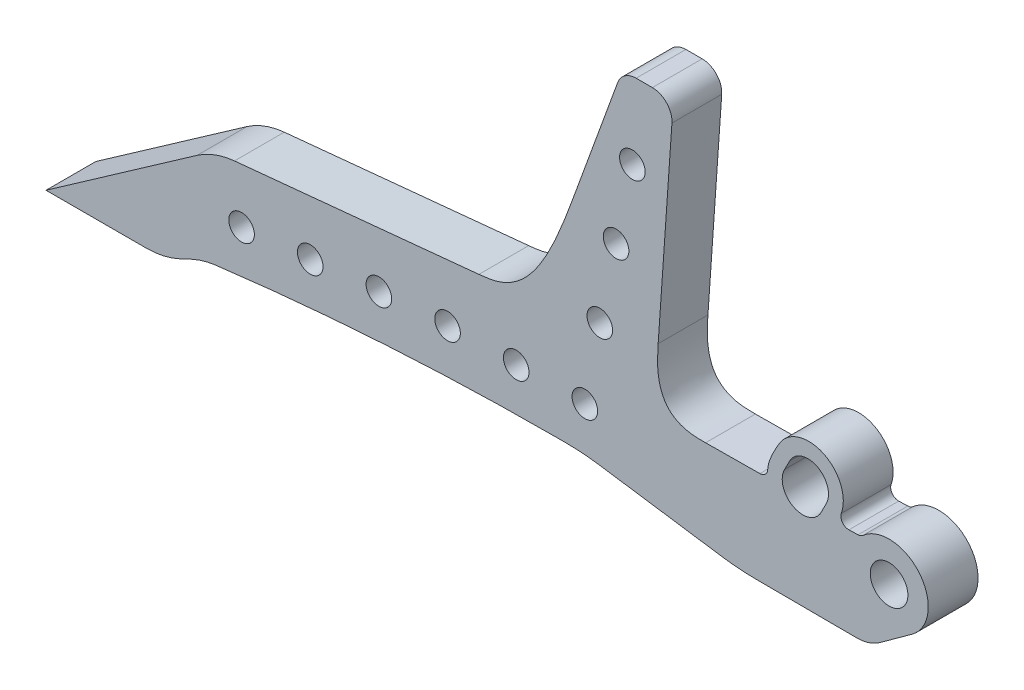
from build123d import *

# Parameters (mm, degrees)
SKETCH1_R               = 3.2639000000591807
SKETCH1_R_2             = 3.26389999999995
SKETCH1_R_3             = 3.263899999999988
SKETCH1_R_4             = 3.2638999999999796
SKETCH1_R_5             = 4.802500000000001
BOSS_EXTRUDE1_DEPTH     = 12.7
EXTRUDE_THIN1_DEPTH     = 12.7
FILLET6_R               = 2
FILLET3_R               = 1
FILLET4_R               = 2
BOSS_EXTRUDE5_DEPTH     = 12.7
CUT_EXTRUDE8_DEPTH      = 12.7
FILLET13_R              = 100
FILLET14_R              = 2
CUT_EXTRUDE9_DEPTH      = 12.7
FILLET16_R              = 2
BOSS_EXTRUDE6_DEPTH     = 12.7
SKETCH18_R              = 3.2638999999999863
CUT_EXTRUDE10_DEPTH     = 12.7
FILLET17_R              = 2
CUT_EXTRUDE11_DEPTH     = 12.7
BOSS_EXTRUDE7_START     = -12.7
BOSS_EXTRUDE7_DEPTH     = 12.7
DELETEFACE1_DEPTH       = 12.7
MOVE_FACE1_DEPTH        = 12.7
MOVE_FACE1_2_DEPTH      = 12.7
MOVE_FACE2_DEPTH        = 12.7
MOVE_FACE2_2_DEPTH      = 12.7
SKETCH27_R              = 3.2639000000000102
CUT_EXTRUDE12_DEPTH     = 12.7
FILLET18_R              = 15
FILLET19_R              = 1
FILLET20_R              = 2
MOVE_START              = -1
MOVE_FACE3_DEPTH        = 15
MOVE_FACE3_2_DEPTH      = 12.7
FILLET21_R              = 2
SKETCH30_R              = 3.2638999999999223
BOSS_EXTRUDE8_DEPTH     = 12.7
FILLET22_DEPTH          = 12.7
FILLET23_OUTLINE_R      = 3.2639
FILLET23_OUTLINE_R_2    = 4.8025
FILLET23_DEPTH          = 12.7
DELETEFACE2_DEPTH       = 12.7
FILLET24_R              = 5
FILLET25_R              = 20
F_1_4_CLEARANCE_HOLE1_D = 6.5278
FILLET26_R              = 10
MOVE_FACE4_DEPTH        = 15
MOVE_FACE4_2_DEPTH      = 12.7
DELETEFACE3_OUTLINE_R   = 3.2639
DELETEFACE3_DEPTH       = 12.7
CUT_EXTRUDE13_DEPTH     = 255.47732308394177
FILLET27_R              = 60
MOVE_FACE5_DEPTH        = 15
MOVE_FACE5_2_DEPTH      = 12.7
MOVE_FACE6_DEPTH        = 15
MOVE_FACE6_2_DEPTH      = 12.7
MOVE_FACE7_DEPTH        = 15
MOVE_FACE7_2_DEPTH      = 12.7


with BuildPart() as part:
    # Sketch1 → Boss-Extrude1 (new body)
    with BuildSketch(Plane.XY):
        with BuildLine():
            Line((-266.80143657759584, 66.76218641072877), (-251.10143657759588, 66.76218641072877))
            Line((-251.10143657759588, 66.76218641072877), (-241.10143657759585, 68.76218641072877))
            Line((-241.10143657759585, 68.76218641072877), (18.198563422404163, 71.2621864107288))
            Line((18.198563422404145, 71.2621864107288), (29.067448443455156, 79.14050878285678))
            ThreePointArc((29.06744844345514, 79.1405087828568), (30.77367137747385, 93.76541277544987), (16.057134993861304, 94.23718641072878))
            Line((16.05713499386129, 94.2371864107288), (-218.52884836858982, 87.76218641072877))
            Line((-218.52884836858982, 87.76218641072877), (-214.52884836858982, 97.76218641072876))
            Line((-214.52884836858982, 97.76218641072876), (-222.52884836858982, 97.76218641072877))
            Line((-222.52884836858982, 97.76218641072877), (-266.80143657759584, 66.76218641072877))
        make_face()
        with Locations((-211.80143657765504, 78.4962764755336)):
            Circle(SKETCH1_R, mode=Mode.SUBTRACT)
        with BuildLine():
            ThreePointArc((-197.55477153455325, 78.76140530191546), (-194.35216687234313, 82.08547055362008), (-191.0281016206385, 78.88286589140998))
            ThreePointArc((-191.0281016206385, 78.88286589140998), (-194.23070628284862, 75.55880063970532), (-197.55477153455325, 78.76140530191546))
        make_face(mode=Mode.SUBTRACT)
        with BuildLine():
            ThreePointArc((-180.04477153455318, 79.08726442304459), (-176.84216687234314, 82.41132967474914), (-173.5181016206386, 79.2087250125391))
            ThreePointArc((-173.5181016206386, 79.2087250125391), (-176.72070628284862, 75.88465976083455), (-180.04477153455318, 79.08726442304459))
        make_face(mode=Mode.SUBTRACT)
        with BuildLine():
            ThreePointArc((-162.53477153455316, 79.41312354417374), (-159.33216687234312, 82.73718879587831), (-156.00810162063857, 79.53458413366826))
            ThreePointArc((-156.00810162063857, 79.53458413366826), (-159.2107062828486, 76.2105188819637), (-162.53477153455316, 79.41312354417374))
        make_face(mode=Mode.SUBTRACT)
        with BuildLine():
            ThreePointArc((-145.02477153455317, 79.73898266530287), (-141.82216687234313, 83.06304791700741), (-138.49810162063858, 79.86044325479739))
            ThreePointArc((-138.49810162063858, 79.86044325479739), (-141.7007062828486, 76.53637800309285), (-145.02477153455317, 79.73898266530287))
        make_face(mode=Mode.SUBTRACT)
        with Locations((-124.25143657759587, 80.12557208117926)):
            Circle(SKETCH1_R_2, mode=Mode.SUBTRACT)
        with Locations((-106.74446789095614, 80.45137478990934)):
            Circle(SKETCH1_R_3, mode=Mode.SUBTRACT)
        with Locations((-89.23749920431642, 80.77717749863945)):
            Circle(SKETCH1_R_4, mode=Mode.SUBTRACT)
        with Locations((-71.72749920431643, 81.10303661976857)):
            Circle(SKETCH1_R_4, mode=Mode.SUBTRACT)
        with BuildLine():
            ThreePointArc((-56.754762895120024, 76.53981461200695), (-61.64181689218387, 81.29068069086881), (-56.93501216729602, 86.22018518435205))
            Line((-56.93501216729602, 86.22018518435205), (11.656298999999152, 88.11343018323176))
            Line((11.656298999999144, 88.11343018323176), (15.73353210661451, 77.2386990605389))
            Line((15.73353210661451, 77.2386990605389), (-56.75476289512002, 76.53981461200695))
        make_face(mode=Mode.SUBTRACT)
        with Locations((23.198563422404142, 87.2371864107288)):
            Circle(SKETCH1_R_5, mode=Mode.SUBTRACT)
    extrude(amount=BOSS_EXTRUDE1_DEPTH)

    # Sketch3 → Extrude-Thin1 (add)
    with BuildSketch(Plane.XY.offset(12.7)):
        Polygon((4.23851569475389, 91.06458037023481), (3.2240886235114283, 89.34093953841095), (-3.1714427213536647, 78.4741169942164), (-4.185869792596126, 76.75047616239254), (0.5541424949194826, 73.96080171647577), (1.5685695661619452, 75.68444254829963), (7.964100911027039, 86.55126509249418), (8.9785279822695, 88.27490592431803), align=None)
        Polygon((-7.406763075990996, 76.77830564243824), (-8.483669150618182, 78.4636166838876), (-15.083552130440083, 88.79214571741373), (-16.160458205067272, 90.47745675886308), (-20.79506356905297, 87.51596505363834), (-19.718157494425785, 85.83065401218899), (-13.118274514603883, 75.50212497866285), (-12.041368439976695, 73.8168139372135), align=None)
        Polygon((-55.7899951575907, 86.92034511324596), (-54.71308908296352, 85.2350340717966), (-48.113206103141636, 74.90650503827047), (-47.03630002851442, 73.2211939968211), (-42.40169466452873, 76.18268570204587), (-43.47860073915594, 77.86799674349523), (-50.078483718977814, 88.19652577702135), (-51.155389793605, 89.8818368184707), align=None)
        Polygon((-30.75641589378383, 90.46896042984243), (-31.770842965026297, 88.74531959801857), (-38.166374309891424, 77.87849705382402), (-39.180801381133875, 76.15485622200013), (-34.440789093618235, 73.36518177608342), (-33.4263620223758, 75.08882260790728), (-27.030830677510696, 85.9556451521018), (-26.016403606268227, 87.67928598392565), align=None)
    extrude(amount=-EXTRUDE_THIN1_DEPTH)

    # Fillet6
    fillet6_edges = [part.edges().sort_by_distance(p)[0] for p in [
        (-7.557461830285362, 77.01414262073078, 6.35),
        (-14.19392431363032, 87.39991698198847, 6.35),
        (-38.85265723218085, 76.71241493656285, 6.35),
        (-32.865984777989965, 86.88453413697027, 6.35),
        (-32.43439817080589, 76.77429556769837, 6.35),
        (-26.378761771838654, 87.0635932962719, 6.35),
        (-49.20340567941775, 76.61261983005267, 6.35),
        (-55.370195509168596, 86.26337697150039, 6.35),
        (-42.71638567476635, 76.6751634089637, 6.35),
        (-48.956334511563355, 86.44041120587461, 6.35),
        (15.73353210661451, 77.2386990605389, 6.35),
        (11.656298999999148, 88.11343018323176, 6.35),
        (-4.01056610828334, 77.0483394556903, 6.35),
        (2.350483264193575, 87.85657273580173, 6.35),
        (2.4076929530916638, 77.1102200868258, 6.35),
        (8.837706270344885, 88.03563189510338, 6.35),
    ]]
    fillet(fillet6_edges, radius=FILLET6_R)

    # Fillet3
    fillet3_edges = [part.edges().sort_by_distance(p)[0] for p in [
        (-218.52884836858982, 87.76218641072877, 6.35),
    ]]
    fillet(fillet3_edges, radius=FILLET3_R)

    # Fillet4
    fillet4_edges = [part.edges().sort_by_distance(p)[0] for p in [
        (-222.52884836858982, 97.76218641072877, 6.35),
    ]]
    fillet(fillet4_edges, radius=FILLET4_R)

    # Sketch15 → Boss-Extrude5 (add)
    with BuildSketch(Plane(origin=(0, 0, 0), x_dir=(-1, 0, 0), z_dir=(0, 0, -1))):
        with BuildLine():
            ThreePointArc((-10.240564524632818, 95.1778583479994), (-9.9177105196129, 94.62521405174513), (-9.618412163576695, 94.05946594453326))
            Line((-9.61841216357666, 94.05946594453334), (-5.586658581399142, 93.94818220937401))
            ThreePointArc((-5.586658581399177, 93.94818220937391), (-6.0603930029386435, 94.84734531832261), (-6.352002714147692, 95.82093782803815))
            ThreePointArc((-6.3520027141475826, 95.82093782803821), (-4.888389862180489, 104.07120111590237), (2.6465033952216066, 100.40590569819335))
            ThreePointArc((2.6465033952215085, 100.4059056981933), (3.686135653718953, 98.75246540321154), (4.049440419621603, 96.833426662318))
            ThreePointArc((4.049440419621603, 96.833426662318), (3.7853654756579207, 95.18933076013064), (3.019706577492367, 93.71063087060655))
            Line((3.0197065774923537, 93.7106308706066), (7.309930070780766, 93.59221289558153))
            ThreePointArc((7.309930070780748, 93.59221289558158), (7.772330747705386, 96.70964864991686), (7.1069949427972805, 99.7901597008848))
            ThreePointArc((7.106994942797279, 99.7901597008848), (6.028678087284767, 102.12920977843532), (4.770165568821003, 104.37644557982365))
            ThreePointArc((4.770165568821006, 104.37644557982365), (-7.334493093818023, 107.28251701063843), (-10.240564524632823, 95.1778583479994))
        make_face()
    extrude(amount=-BOSS_EXTRUDE5_DEPTH)

    # Sketch15<3> → Cut-Extrude8 (cut)
    with BuildSketch(Plane(origin=(0, 0, 0), x_dir=(-1, 0, 0), z_dir=(0, 0, -1))):
        with BuildLine():
            Line((3.0197065774923537, 93.7106308706066), (-5.586658581399142, 93.94818220937401))
            ThreePointArc((-5.586658581399177, 93.94818220937391), (-1.345413964517593, 91.58542540399158), (3.019706577492367, 93.71063087060655))
        make_face()
    extrude(amount=-CUT_EXTRUDE8_DEPTH, mode=Mode.SUBTRACT)

    # Fillet13
    fillet13_edges = [part.edges().sort_by_distance(p)[0] for p in [
        (6.352002714147638, 95.82093782803818, 6.35),
        (-2.646503395221557, 100.40590569819332, 6.35),
    ]]
    fillet(fillet13_edges, radius=FILLET13_R)

    # Fillet14
    fillet14_edges = [part.edges().sort_by_distance(p)[0] for p in [
        (16.057134993861297, 94.23718641072878, 6.35),
        (-7.309930070780759, 93.59221289558155, 6.35),
        (9.618412163576679, 94.0594659445333, 6.35),
    ]]
    fillet(fillet14_edges, radius=FILLET14_R)

    # Sketch17 → Cut-Extrude9 (cut)
    with BuildSketch(Plane(origin=(0, 0, 0), x_dir=(-1, 0, 0), z_dir=(0, 0, -1))):
        Polygon((225.77116314741176, 83.89453456811516), (237.69504542805052, 75.54534231048676), (222.69504542805052, 75.68996244160903), align=None)
    extrude(amount=-CUT_EXTRUDE9_DEPTH, mode=Mode.SUBTRACT)

    # Fillet16
    fillet16_edges = [part.edges().sort_by_distance(p)[0] for p in [
        (-237.69504542805052, 75.54534231048676, 6.35),
        (-225.77116314741176, 83.89453456811516, 6.35),
        (-222.69504542805052, 75.68996244160903, 6.35),
    ]]
    fillet(fillet16_edges, radius=FILLET16_R)

    # Sketch20 → Boss-Extrude6 (add)
    with BuildSketch(Plane(origin=(0, 0, 0), x_dir=(-1, 0, 0), z_dir=(0, 0, -1))):
        Polygon((24.34448183493676, 87.1197431241629), (24.344481834936765, 76.85229321844913), (33.994868442922936, 72.80053303021572), (65.80234868872179, 76.85229321844913), (61.329456714620974, 89.56218104664258), align=None)
    extrude(amount=-BOSS_EXTRUDE6_DEPTH)

    # Sketch18 → Cut-Extrude10 (cut)
    with BuildSketch(Plane(origin=(0, 0, 0), x_dir=(-1, 0, 0), z_dir=(0, 0, -1))):
        with Locations((54.220530517676686, 81.42883932849865)):
            Circle(SKETCH18_R)
        with Locations((36.713561831036955, 81.75464203722872)):
            Circle(SKETCH18_R)
    extrude(amount=-CUT_EXTRUDE10_DEPTH, mode=Mode.SUBTRACT)

    # Fillet17
    fillet17_edges = [part.edges().sort_by_distance(p)[0] for p in [
        (-14.044481834936764, 76.95159904181975, 6.35),
        (-20.607785311235563, 87.22288274761424, 6.35),
        (-24.344481834936765, 76.85229321844913, 6.35),
        (-24.34448183493676, 87.1197431241629, 6.35),
    ]]
    fillet(fillet17_edges, radius=FILLET17_R)

    # Sketch21 → Cut-Extrude11 (cut)
    with BuildSketch(Plane(origin=(0, 0, 0), x_dir=(-1, 0, 0), z_dir=(0, 0, -1))):
        Polygon((-18.198563422404163, 71.2621864107288), (237.09752046296765, 68.80078953562877), (218.10143657759585, 72.32003446317768), align=None)
    extrude(amount=-CUT_EXTRUDE11_DEPTH, mode=Mode.SUBTRACT)

    # Sketch23 → Boss-Extrude7 (add)
    with BuildSketch(Plane(origin=(0, 0, 0), x_dir=(-1, 0, 0), z_dir=(0, 0, -1)).offset(BOSS_EXTRUDE7_START)):
        with BuildLine():
            Line((214.13279750664506, 93.43564848974188), (7.7608793389252, 95.23662893531686))
            ThreePointArc((7.7608793389252035, 95.2366289353169), (8.411151209401176, 94.03105895524098), (9.684666065562755, 93.52666586098974))
            Line((9.684666065562766, 93.52666586098974), (217.00758047618953, 87.80417617270051))
            ThreePointArc((217.00758047618953, 87.80417617270051), (217.85542522201777, 88.23179519506506), (217.96364847833937, 89.1751861363549))
            Line((217.96364847833937, 89.1751861363549), (214.52884836858982, 97.76218641072876))
            Line((214.52884836858982, 97.76218641072876), (221.89825079083187, 97.76218641072879))
            ThreePointArc((221.89825079083187, 97.7621864107288), (222.49966238984044, 97.66962031222523), (223.045403663534, 97.40049049930676))
            Line((223.045403663534, 97.40049049930676), (216.1021823382503, 102.26218641072876))
            Line((216.1021823382503, 102.26218641072876), (210.6021823382503, 102.26218641072876))
            Line((210.6021823382503, 102.26218641072876), (214.13279750664506, 93.43564848974188))
        make_face()
        Polygon((241.10143657759585, 68.76218641072876), (251.10143657759588, 66.76218641072876), (248.10143657759588, 66.76218641072876), (237.09752046296722, 68.80078953562877), align=None)
    extrude(amount=BOSS_EXTRUDE7_DEPTH)

    # DeleteFace1: read off the stored shape, not the designer's step
    # DeleteFace1 outline → DeleteFace1 (add)
    with BuildSketch(Plane.XY):
        with BuildLine():
            ThreePointArc((-232.41031363, 79.245751353), (-233.167673391, 76.996847862), (-231.24387897, 75.607540213))
            Line((-231.24387897, 75.607540213), (-225.551208697, 75.662425195))
            ThreePointArc((-225.551208697, 75.662425195), (-223.921202956, 76.531027402), (-223.697787346, 78.364459696))
            Line((-223.697787346, 78.364459696), (-224.86520894, 81.478187952))
            ThreePointArc((-224.86520894, 81.478187952), (-226.145702257, 82.686371348), (-227.88506495, 82.414364591))
            Line((-227.88506495, 82.414364591), (-232.41031363, 79.245751353))
        make_face()
    extrude(amount=DELETEFACE1_DEPTH)

    # Move Face1: read off the stored shape, not the designer's step
    # Move Face1 outline → Move Face1 (cut)
    with BuildSketch(Plane.XY):
        with BuildLine():
            ThreePointArc((-24.50537332, 79.036329201), (-24.314016139, 78.162656149), (-23.76098511, 77.45974872))
            ThreePointArc((-23.76098511, 77.45974872), (-24.192860388, 78.107799283), (-24.344481835, 78.871668856))
            Line((-24.344481835, 78.871668856), (-24.344481835, 85.174185048))
            ThreePointArc((-24.344481835, 85.174185048), (-23.778072649, 86.568752141), (-22.399664457, 87.173423623))
            Line((-22.399664457, 87.173423623), (-21.73896166, 87.191660222))
            ThreePointArc((-21.73896166, 87.191660222), (-20.831207894, 87.001598932), (-20.106786806, 86.422501117))
            ThreePointArc((-20.106786806, 86.422501117), (-20.845075734, 87.097267125), (-21.817771072, 87.330169438))
            Line((-21.817771072, 87.330169438), (-22.47862181, 87.318462088))
            ThreePointArc((-22.47862181, 87.318462088), (-23.862937429, 86.727440083), (-24.443098586, 85.33853772))
            Line((-24.443098586, 85.33853772), (-24.50537332, 79.036329201))
        make_face()
        with BuildLine():
            ThreePointArc((-8.324891511, 77.952555147), (-7.598664142, 77.263529538), (-6.629502006, 77.012756264))
            Line((-6.629502006, 77.012756264), (-5.321302588, 77.012442231))
            ThreePointArc((-5.321302588, 77.012442231), (-5.126611216, 77.021894012), (-4.933764563, 77.050253049))
            ThreePointArc((-4.933764563, 77.050253049), (-5.037390445, 77.041144937), (-5.141349734, 77.037437184))
            Line((-5.141349734, 77.037437184), (-6.449488392, 77.024824972))
            ThreePointArc((-6.449488392, 77.024824972), (-7.42108109, 77.266009779), (-8.154081221, 77.947825948))
            Line((-8.154081221, 77.947825948), (-12.290602901, 84.421301978))
            ThreePointArc((-12.290602901, 84.421301978), (-12.372491912, 86.434692957), (-10.660474482, 87.497446627))
            Line((-10.660474482, 87.497446627), (-7.587445764, 87.582267811))
            Line((-7.587445764, 87.582267811), (-10.736803264, 87.526475137))
            ThreePointArc((-10.736803264, 87.526475137), (-12.459238114, 86.480689676), (-12.39724728, 84.466587846))
            Line((-12.39724728, 84.466587846), (-8.324891511, 77.952555147))
        make_face()
        with BuildLine():
            ThreePointArc((4.052243065, 80.041189569), (4.024564038, 78.025819476), (5.765296169, 77.0097809))
            Line((5.765296169, 77.0097809), (12.698252915, 77.008116648))
            ThreePointArc((12.698252915, 77.008116648), (13.630682373, 77.238520481), (14.348178535, 77.877042115))
            ThreePointArc((14.348178535, 77.877042115), (13.68295132, 77.389092208), (12.877368838, 77.211161813))
            Line((12.877368838, 77.211161813), (5.944734099, 77.14432191))
            ThreePointArc((5.944734099, 77.14432191), (4.194047538, 78.14311083), (4.201811479, 80.158656033))
            Line((4.201811479, 80.158656033), (7.670211631, 86.051909765))
            Line((7.670211631, 86.051909765), (4.052243065, 80.041189569))
        make_face()
        with BuildLine():
            ThreePointArc((-208.785112786, 79.743206302), (-212.207698907, 83.767453494), (-214.973209883, 79.266274731))
            ThreePointArc((-214.973209883, 79.266274731), (-212.052249394, 81.750525413), (-208.785112786, 79.743206302))
        make_face()
        with BuildLine():
            ThreePointArc((-103.621952617, 81.401607168), (-107.351955287, 84.660576236), (-110.008243114, 80.479914293))
            ThreePointArc((-110.008243114, 80.479914293), (-107.210695338, 83.681804355), (-103.621952617, 81.401607168))
        make_face()
        with BuildLine():
            ThreePointArc((-92.498078721, 80.6299891), (-89.791939616, 83.993641247), (-86.11581505, 81.730136708))
            ThreePointArc((-86.11581505, 81.730136708), (-89.930834979, 84.799412057), (-92.498078721, 80.6299891))
        make_face()
        with BuildLine():
            ThreePointArc((-74.970511489, 80.734370741), (-72.415927954, 84.293508226), (-68.621017286, 82.104442284))
            ThreePointArc((-68.621017286, 82.104442284), (-72.552458321, 84.926248011), (-74.970511489, 80.734370741))
        make_face()
        with BuildLine():
            ThreePointArc((-191.248663435, 80.003056766), (-194.714568399, 83.918741932), (-197.487294238, 79.485111483))
            ThreePointArc((-197.487294238, 79.485111483), (-194.561483882, 82.074844877), (-191.248663435, 80.003056766))
        make_face()
        with BuildLine():
            ThreePointArc((-173.715281989, 80.26680625), (-177.225383788, 84.069562322), (-179.998310688, 79.700049215))
            ThreePointArc((-179.998310688, 79.700049215), (-177.074664267, 82.398696293), (-173.715281989, 80.26680625))
        make_face()
        with BuildLine():
            ThreePointArc((-156.185127552, 80.535804782), (-159.741493142, 84.21969608), (-162.50610013, 79.9097379))
            ThreePointArc((-162.50610013, 79.9097379), (-159.593138616, 82.721861076), (-156.185127552, 80.535804782))
        make_face()
        with BuildLine():
            ThreePointArc((-138.658513403, 80.812091832), (-142.264934226, 84.368778203), (-145.010349283, 80.112138066))
            ThreePointArc((-145.010349283, 80.112138066), (-142.118944696, 83.043974225), (-138.658513403, 80.812091832))
        make_face()
        with BuildLine():
            ThreePointArc((-121.136042829, 81.098898849), (-124.798937068, 84.516160777), (-127.510454861, 80.304018265))
            ThreePointArc((-127.510454861, 80.304018265), (-124.655312534, 83.364387825), (-121.136042829, 81.098898849))
        make_face()
        with BuildLine():
            ThreePointArc((-39.741602066, 80.536440271), (-38.076726294, 84.720249202), (-33.81732279, 83.259581446))
            ThreePointArc((-33.81732279, 83.259581446), (-38.208527488, 85.006986845), (-39.741602066, 80.536440271))
        make_face()
        with BuildLine():
            ThreePointArc((-57.412375767, 80.746807718), (-55.134895592, 84.562045309), (-51.162851049, 82.570609653))
            ThreePointArc((-51.162851049, 82.570609653), (-55.269061372, 85.021784024), (-57.412375767, 80.746807718))
        make_face()
    extrude(amount=MOVE_FACE1_DEPTH, mode=Mode.SUBTRACT)

    # Move Face1 2 outline → Move Face1 2 (add)
    with BuildSketch(Plane.XY):
        with BuildLine():
            Line((-17.834875183, 77.015446106), (-22.505951054, 77.016567395))
            ThreePointArc((-22.505951054, 77.016567395), (-23.171416008, 77.13069428), (-23.76098511, 77.45974872))
            ThreePointArc((-23.76098511, 77.45974872), (-23.102432443, 77.020855285), (-22.325200047, 76.871761805))
            Line((-22.325200047, 76.871761805), (-17.654341127, 76.916795154))
            ThreePointArc((-17.654341127, 76.916795154), (-15.914900671, 77.964391295), (-15.988311874, 79.993608279))
            Line((-15.988311874, 79.993608279), (-19.998467996, 86.269327722))
            ThreePointArc((-19.998467996, 86.269327722), (-20.050830421, 86.34718518), (-20.106786806, 86.422501117))
            ThreePointArc((-20.106786806, 86.422501117), (-20.096556278, 86.406640609), (-20.086475879, 86.390684265))
            Line((-20.086475879, 86.390684265), (-16.13852548, 80.075647108))
            ThreePointArc((-16.13852548, 80.075647108), (-16.085168416, 78.045803814), (-17.834875183, 77.015446106))
        make_face()
        with BuildLine():
            ThreePointArc((-3.607289287, 77.981033446), (-4.172036691, 77.375282685), (-4.933764563, 77.050253049))
            ThreePointArc((-4.933764563, 77.050253049), (-4.070842996, 77.360334703), (-3.436990691, 78.022917164))
            Line((-3.436990691, 78.022917164), (0.51816646, 84.743233048))
            ThreePointArc((0.51816646, 84.743233048), (0.516873837, 86.774280326), (-1.260656995, 87.756898694))
            Line((-1.260656995, 87.756898694), (-7.587445764, 87.582267811))
            Line((-7.587445764, 87.582267811), (-1.334881025, 87.693035582))
            ThreePointArc((-1.334881025, 87.693035582), (0.432853847, 86.692901522), (0.414077766, 84.661940622))
            Line((0.414077766, 84.661940622), (-3.607289287, 77.981033446))
        make_face()
        with BuildLine():
            ThreePointArc((14.578282404, 79.691705712), (14.682845476, 78.756526183), (14.348178535, 77.877042115))
            ThreePointArc((14.348178535, 77.877042115), (14.823685661, 78.84171524), (14.730790188, 79.913196315))
            Line((14.730790188, 79.913196315), (12.157386783, 86.776936838))
            ThreePointArc((12.157386783, 86.776936838), (11.401137641, 87.734185921), (10.229501023, 88.074047963))
            Line((10.229501023, 88.074047963), (9.944546379, 88.066182696))
            ThreePointArc((9.944546379, 88.066182696), (8.983108795, 87.789292331), (8.27608817, 87.081371193))
            Line((8.27608817, 87.081371193), (7.670211631, 86.051909765))
            Line((7.670211631, 86.051909765), (8.194723737, 86.923309129))
            ThreePointArc((8.194723737, 86.923309129), (8.908704768, 87.624209685), (9.872831352, 87.891586634))
            Line((9.872831352, 87.891586634), (10.1578498, 87.896635899))
            ThreePointArc((10.1578498, 87.896635899), (11.326071068, 87.545213586), (12.07282478, 86.580538788))
            Line((12.07282478, 86.580538788), (14.578282404, 79.691705712))
        make_face()
        with BuildLine():
            ThreePointArc((-208.785112786, 79.743206302), (-211.706073275, 77.25895562), (-214.973209883, 79.266274731))
            ThreePointArc((-214.973209883, 79.266274731), (-211.550623762, 75.242027539), (-208.785112786, 79.743206302))
        make_face()
        with BuildLine():
            ThreePointArc((-103.621952617, 81.401607168), (-106.419500393, 78.199717106), (-110.008243114, 80.479914293))
            ThreePointArc((-110.008243114, 80.479914293), (-106.278240444, 77.220945225), (-103.621952617, 81.401607168))
        make_face()
        with BuildLine():
            ThreePointArc((-86.11581505, 81.730136708), (-88.821954155, 78.366484561), (-92.498078721, 80.6299891))
            ThreePointArc((-92.498078721, 80.6299891), (-88.683058792, 77.560713751), (-86.11581505, 81.730136708))
        make_face()
        with BuildLine():
            ThreePointArc((-68.621017286, 82.104442284), (-71.175600821, 78.545304799), (-74.970511489, 80.734370741))
            ThreePointArc((-74.970511489, 80.734370741), (-71.039070454, 77.912565014), (-68.621017286, 82.104442284))
        make_face()
        with BuildLine():
            ThreePointArc((-191.248663435, 80.003056766), (-194.174473791, 77.413323372), (-197.487294238, 79.485111483))
            ThreePointArc((-197.487294238, 79.485111483), (-194.021389274, 75.569426317), (-191.248663435, 80.003056766))
        make_face()
        with BuildLine():
            ThreePointArc((-173.715281989, 80.26680625), (-176.63892841, 77.568159172), (-179.998310688, 79.700049215))
            ThreePointArc((-179.998310688, 79.700049215), (-176.488208889, 75.897293143), (-173.715281989, 80.26680625))
        make_face()
        with BuildLine():
            ThreePointArc((-156.185127552, 80.535804782), (-159.098089066, 77.723681606), (-162.50610013, 79.9097379))
            ThreePointArc((-162.50610013, 79.9097379), (-158.94973454, 76.225846602), (-156.185127552, 80.535804782))
        make_face()
        with BuildLine():
            ThreePointArc((-138.658513403, 80.812091832), (-141.54991799, 77.880255673), (-145.010349283, 80.112138066))
            ThreePointArc((-145.010349283, 80.112138066), (-141.40392846, 76.555451695), (-138.658513403, 80.812091832))
        make_face()
        with BuildLine():
            ThreePointArc((-121.136042829, 81.098898849), (-123.991185156, 78.038529289), (-127.510454861, 80.304018265))
            ThreePointArc((-127.510454861, 80.304018265), (-123.847560622, 76.886756337), (-121.136042829, 81.098898849))
        make_face()
        with BuildLine():
            ThreePointArc((-33.81732279, 83.259581446), (-35.482198562, 79.075772515), (-39.741602066, 80.536440271))
            ThreePointArc((-39.741602066, 80.536440271), (-35.350397368, 78.789034872), (-33.81732279, 83.259581446))
        make_face()
        with BuildLine():
            ThreePointArc((-51.162851049, 82.570609653), (-53.440331224, 78.755372062), (-57.412375767, 80.746807718))
            ThreePointArc((-57.412375767, 80.746807718), (-53.306165444, 78.295633347), (-51.162851049, 82.570609653))
        make_face()
    extrude(amount=MOVE_FACE1_2_DEPTH)

    # Move Face2: read off the stored shape, not the designer's step
    # Move Face2 outline → Move Face2 (cut)
    with BuildSketch(Plane.XY):
        with BuildLine():
            ThreePointArc((-24.52640427, 81.446237436), (-24.517255088, 81.234377245), (-24.485725635, 81.024676646))
            Line((-24.485725635, 81.024676646), (-24.443098586, 85.33853772))
            ThreePointArc((-24.443098586, 85.33853772), (-23.862937429, 86.727440083), (-22.47862181, 87.318462088))
            Line((-22.47862181, 87.318462088), (-21.817771072, 87.330169438))
            ThreePointArc((-21.817771072, 87.330169438), (-20.828444713, 87.088343644), (-20.086475879, 86.390684265))
            Line((-20.086475879, 86.390684265), (-16.242777815, 80.242406389))
            ThreePointArc((-16.242777815, 80.242406389), (-15.856801043, 81.351204798), (-16.15955643, 82.485555342))
            Line((-16.15955643, 82.485555342), (-20.10750683, 88.800592499))
            ThreePointArc((-20.10750683, 88.800592499), (-20.849475663, 89.498251878), (-21.838802022, 89.740077673))
            Line((-21.838802022, 89.740077673), (-22.499652761, 89.728370323))
            ThreePointArc((-22.499652761, 89.728370323), (-23.88396838, 89.137348317), (-24.464129537, 87.748445954))
            Line((-24.464129537, 87.748445954), (-24.52640427, 81.446237436))
        make_face()
        with BuildLine():
            ThreePointArc((-208.934199045, 81.744629031), (-212.006399579, 86.186888512), (-215.000604087, 81.691688317))
            ThreePointArc((-215.000604087, 81.691688317), (-211.985368629, 83.776980278), (-208.934199045, 81.744629031))
        make_face()
        with BuildLine():
            ThreePointArc((-103.863040795, 82.661571145), (-106.935241328, 87.103830627), (-109.929445835, 82.608630432))
            ThreePointArc((-109.929445835, 82.608630432), (-106.914210378, 84.693922392), (-103.863040795, 82.661571145))
        make_face()
        with BuildLine():
            ThreePointArc((-86.353707522, 82.814372783), (-89.425908055, 87.256632265), (-92.420112562, 82.76143207))
            ThreePointArc((-92.420112562, 82.76143207), (-89.404877105, 84.84672403), (-86.353707522, 82.814372783))
        make_face()
        with BuildLine():
            ThreePointArc((-68.841342526, 82.96720088), (-71.913543062, 87.40946036), (-74.907747567, 82.914260164))
            ThreePointArc((-74.907747567, 82.914260164), (-71.892512111, 84.999552126), (-68.841342526, 82.96720088))
        make_face()
        with BuildLine():
            ThreePointArc((-191.42183405, 81.897457126), (-194.494034583, 86.339716608), (-197.48823909, 81.844516413))
            ThreePointArc((-197.48823909, 81.844516413), (-194.473003633, 83.929808373), (-191.42183405, 81.897457126))
        make_face()
        with BuildLine():
            ThreePointArc((-173.909469054, 82.050285222), (-176.98166959, 86.492544703), (-179.975874095, 81.997344507))
            ThreePointArc((-179.975874095, 81.997344507), (-176.960638639, 84.082636468), (-173.909469054, 82.050285222))
        make_face()
        with BuildLine():
            ThreePointArc((-156.397104058, 82.203113317), (-159.469304592, 86.645372798), (-162.4635091, 82.150172603))
            ThreePointArc((-162.4635091, 82.150172603), (-159.448273642, 84.235464564), (-156.397104058, 82.203113317))
        make_face()
        with BuildLine():
            ThreePointArc((-138.884739063, 82.355941413), (-141.956939599, 86.798200894), (-144.951144104, 82.303000698))
            ThreePointArc((-144.951144104, 82.303000698), (-141.935908648, 84.388292659), (-138.884739063, 82.355941413))
        make_face()
        with BuildLine():
            ThreePointArc((-121.372374067, 82.508769508), (-124.444574603, 86.951028989), (-127.438779108, 82.455828793))
            ThreePointArc((-127.438779108, 82.455828793), (-124.423543652, 84.541120754), (-121.372374067, 82.508769508))
        make_face()
        with BuildLine():
            ThreePointArc((-33.82267598, 83.272804155), (-36.894876516, 87.715063636), (-39.889081021, 83.21986344))
            ThreePointArc((-39.889081021, 83.21986344), (-36.873845565, 85.305155401), (-33.82267598, 83.272804155))
        make_face()
        with BuildLine():
            ThreePointArc((-51.332009253, 83.120002518), (-54.404209789, 87.562261998), (-57.398414294, 83.067061802))
            ThreePointArc((-57.398414294, 83.067061802), (-54.383178838, 85.152353764), (-51.332009253, 83.120002518))
        make_face()
    extrude(amount=MOVE_FACE2_DEPTH, mode=Mode.SUBTRACT)

    # Move Face2 2 outline → Move Face2 2 (add)
    with BuildSketch(Plane.XY):
        with BuildLine():
            Line((-17.855906133, 79.425354341), (-22.526982004, 79.42647563))
            ThreePointArc((-22.526982004, 79.42647563), (-23.790887683, 79.876853488), (-24.485725635, 81.024676646))
            Line((-24.485725635, 81.024676646), (-24.50537332, 79.036329201))
            ThreePointArc((-24.50537332, 79.036329201), (-23.926823107, 77.609528581), (-22.505951054, 77.016567395))
            Line((-22.505951054, 77.016567395), (-17.834875183, 77.015446106))
            ThreePointArc((-17.834875183, 77.015446106), (-16.085168416, 78.045803814), (-16.13852548, 80.075647108))
            Line((-16.13852548, 80.075647108), (-16.242777815, 80.242406389))
            ThreePointArc((-16.242777815, 80.242406389), (-16.951730829, 79.641163997), (-17.855906133, 79.425354341))
        make_face()
        with BuildLine():
            ThreePointArc((-208.934199045, 81.744629031), (-211.949434503, 79.65933707), (-215.000604087, 81.691688317))
            ThreePointArc((-215.000604087, 81.691688317), (-211.928403553, 77.249428836), (-208.934199045, 81.744629031))
        make_face()
        with BuildLine():
            ThreePointArc((-103.863040795, 82.661571145), (-106.878276252, 80.576279185), (-109.929445835, 82.608630432))
            ThreePointArc((-109.929445835, 82.608630432), (-106.857245302, 78.16637095), (-103.863040795, 82.661571145))
        make_face()
        with BuildLine():
            ThreePointArc((-86.353707522, 82.814372783), (-89.368942979, 80.729080823), (-92.420112562, 82.76143207))
            ThreePointArc((-92.420112562, 82.76143207), (-89.347912029, 78.319172588), (-86.353707522, 82.814372783))
        make_face()
        with BuildLine():
            ThreePointArc((-68.841342526, 82.96720088), (-71.856577982, 80.881908918), (-74.907747567, 82.914260164))
            ThreePointArc((-74.907747567, 82.914260164), (-71.835547031, 78.472000684), (-68.841342526, 82.96720088))
        make_face()
        with BuildLine():
            ThreePointArc((-191.42183405, 81.897457126), (-194.437069507, 79.812165166), (-197.48823909, 81.844516413))
            ThreePointArc((-197.48823909, 81.844516413), (-194.416038557, 77.402256931), (-191.42183405, 81.897457126))
        make_face()
        with BuildLine():
            ThreePointArc((-173.909469054, 82.050285222), (-176.92470451, 79.964993261), (-179.975874095, 81.997344507))
            ThreePointArc((-179.975874095, 81.997344507), (-176.903673559, 77.555085026), (-173.909469054, 82.050285222))
        make_face()
        with BuildLine():
            ThreePointArc((-156.397104058, 82.203113317), (-159.412339516, 80.117821356), (-162.4635091, 82.150172603))
            ThreePointArc((-162.4635091, 82.150172603), (-159.391308566, 77.707913122), (-156.397104058, 82.203113317))
        make_face()
        with BuildLine():
            ThreePointArc((-138.884739063, 82.355941413), (-141.899974519, 80.270649452), (-144.951144104, 82.303000698))
            ThreePointArc((-144.951144104, 82.303000698), (-141.878943568, 77.860741217), (-138.884739063, 82.355941413))
        make_face()
        with BuildLine():
            ThreePointArc((-121.372374067, 82.508769508), (-124.387609523, 80.423477547), (-127.438779108, 82.455828793))
            ThreePointArc((-127.438779108, 82.455828793), (-124.366578572, 78.013569312), (-121.372374067, 82.508769508))
        make_face()
        with BuildLine():
            ThreePointArc((-33.82267598, 83.272804155), (-36.837911436, 81.187512194), (-39.889081021, 83.21986344))
            ThreePointArc((-39.889081021, 83.21986344), (-36.816880485, 78.777603959), (-33.82267598, 83.272804155))
        make_face()
        with BuildLine():
            ThreePointArc((-51.332009253, 83.120002518), (-54.347244709, 81.034710556), (-57.398414294, 83.067061802))
            ThreePointArc((-57.398414294, 83.067061802), (-54.326213758, 78.624802322), (-51.332009253, 83.120002518))
        make_face()
    extrude(amount=MOVE_FACE2_2_DEPTH)

    # Sketch27 → Cut-Extrude12 (cut)
    with BuildSketch(Plane(origin=(0, 0, 0), x_dir=(-1, 0, 0), z_dir=(0, 0, -1))):
        with Locations((228.9779170411141, 79.67311279137762)):
            Circle(SKETCH27_R)
    extrude(amount=-CUT_EXTRUDE12_DEPTH, mode=Mode.SUBTRACT)

    # Fillet18
    fillet18_edges = [part.edges().sort_by_distance(p)[0] for p in [
        (-218.10143657759585, 72.32003446317768, 6.35),
    ]]
    fillet(fillet18_edges, radius=FILLET18_R)

    # Fillet19
    fillet19_edges = [part.edges().sort_by_distance(p)[0] for p in [
        (-214.13279750664506, 93.43564848974188, 6.35),
    ]]
    fillet(fillet19_edges, radius=FILLET19_R)

    # Fillet20
    fillet20_edges = [part.edges().sort_by_distance(p)[0] for p in [
        (-216.1021823382503, 102.26218641072876, 6.35),
    ]]
    fillet(fillet20_edges, radius=FILLET20_R)

    # Move Face3: read off the stored shape, not the designer's step
    # Move Face3 outline → Move Face3 (cut)
    with BuildSketch(Plane.XY.offset(MOVE_START)):
        with BuildLine():
            ThreePointArc((-24.533814969, 80.696274049), (-23.955264756, 79.269473429), (-22.534392703, 78.676512243))
            Line((-22.534392703, 78.676512243), (-17.863316832, 78.675390954))
            ThreePointArc((-17.863316832, 78.675390954), (-16.328203926, 79.39285351), (-15.894698081, 81.03096121))
            ThreePointArc((-15.894698081, 81.03096121), (-16.588486309, 79.877819555), (-17.855906133, 79.425354341))
            Line((-17.855906133, 79.425354341), (-22.526982004, 79.42647563))
            ThreePointArc((-22.526982004, 79.42647563), (-23.947854057, 80.019436816), (-24.52640427, 81.446237436))
            Line((-24.52640427, 81.446237436), (-24.533814969, 80.696274049))
        make_face()
    extrude(amount=MOVE_FACE3_DEPTH, mode=Mode.SUBTRACT)

    # Move Face3 2 outline → Move Face3 2 (add)
    with BuildSketch(Plane.XY):
        with BuildLine():
            ThreePointArc((-16.166967129, 81.735591955), (-15.997263029, 81.396247854), (-15.894698081, 81.03096121))
            ThreePointArc((-15.894698081, 81.03096121), (-15.887778341, 81.783631487), (-16.15955643, 82.485555342))
            Line((-16.15955643, 82.485555342), (-20.10750683, 88.800592499))
            ThreePointArc((-20.10750683, 88.800592499), (-20.849475663, 89.498251878), (-21.838802022, 89.740077673))
            Line((-21.838802022, 89.740077673), (-22.499652761, 89.728370323))
            ThreePointArc((-22.499652761, 89.728370323), (-23.88396838, 89.137348317), (-24.464129537, 87.748445954))
            Line((-24.464129537, 87.748445954), (-24.471540236, 86.998482568))
            ThreePointArc((-24.471540236, 86.998482568), (-23.891379078, 88.387384931), (-22.507063459, 88.978406936))
            Line((-22.507063459, 88.978406936), (-21.846212721, 88.990114286))
            ThreePointArc((-21.846212721, 88.990114286), (-20.856886362, 88.748288492), (-20.114917528, 88.050629113))
            Line((-20.114917528, 88.050629113), (-16.166967129, 81.735591955))
        make_face()
    extrude(amount=MOVE_FACE3_2_DEPTH)

    # Fillet21
    fillet21_edges = [part.edges().sort_by_distance(p)[0] for p in [
        (-7.760879338925202, 95.23662893531687, 6.35),
    ]]
    fillet(fillet21_edges, radius=FILLET21_R)

    # Split1
    split(bisect_by=Plane(origin=(-94.4687078334765, 134.91529679188227, 0), x_dir=(0.819152044288991, 0.5735764363510473, 0), z_dir=(-0.5735764363510473, 0.819152044288991, 0)), keep=Keep.BOTTOM)

    # Sketch30 → Boss-Extrude8 (add)
    with BuildSketch(Plane(origin=(0, 0, 0), x_dir=(-1, 0, 0), z_dir=(0, 0, -1))):
        with BuildLine():
            Line((161.80143657759587, 66.76218641072877), (191.80143657759587, 66.76218641072877))
            Line((191.80143657759587, 66.76218641072876), (148.95699637533255, 96.76218641072876))
            Line((148.95699637533255, 96.76218641072876), (67.3675911021002, 104.76218641072875))
            Line((67.3675911021002, 104.76218641072875), (44.80143657759586, 166.76218641072873))
            Line((44.80143657759586, 166.76218641072873), (31.80143657759586, 166.76218641072873))
            Line((31.80143657759586, 166.76218641072873), (36.80143657759585, 94.98319583172503))
            Line((36.80143657759585, 94.98319583172503), (102.51103034014116, 94.40975689437482))
            Line((102.51103034014116, 94.40975689437482), (121.68214986180807, 85.47011704601674))
            ThreePointArc((121.68214986180807, 85.47011704601674), (125.79547580746942, 86.64535125418747), (127.53918912541015, 82.73893478328455))
            Line((127.53918912541015, 82.73893478328455), (161.80143657759587, 66.76218641072877))
        make_face()
        with Locations((141.928457058602, 83.5344251727384)):
            Circle(SKETCH30_R, mode=Mode.SUBTRACT)
    extrude(amount=-BOSS_EXTRUDE8_DEPTH)

    # Fillet22: read off the stored shape, not the designer's step
    # Fillet22 outline → Fillet22 (add)
    with BuildSketch(Plane.XY):
        with BuildLine():
            Line((-56.725897241, 134), (-57.113647751, 132.934664229))
            add(Edge.make_bspline(
                [(-57.113647751, 132.934664229), (-58.940158220819, 127.916367956018), (-60.7666686907499, 122.898071683486), (-65.3798669897061, 112.314673847345), (-70.5915001285009, 105.97411241313), (-76.4015681071344, 103.876387380839), (-78.9013177718837, 103.631282060473), (-81.401067437, 103.38617674)],
                knots=[0, 0, 0, 0, 0, 0, 0.5, 0.5, 1, 1, 1, 1, 1, 1], degree=5))
            Line((-81.401067437, 103.38617674), (-83, 103.22939829))
            Line((-83, 103.22939829), (-83, 102))
            Line((-83, 102), (-56, 102))
            Line((-56, 102), (-56, 134))
            Line((-56, 134), (-56.725897241, 134))
        make_face()
    extrude(amount=FILLET22_DEPTH)

    # Fillet23: read off the stored shape, not the designer's step
    # Fillet23 outline → Fillet23 (add)
    with BuildSketch(Plane.XY):
        with BuildLine():
            Line((-191.801436578, 66.762186411), (-161.801436578, 66.762186411))
            Line((-161.801436578, 66.762186411), (-150.531289956, 72.017542089))
            Line((-150.531289956, 72.017542089), (18.198563422, 71.262186411))
            Line((18.198563422, 71.262186411), (29.067448443, 79.140508783))
            ThreePointArc((29.067448443, 79.140508783), (30.997195748, 93.496685899), (16.563560566, 94.718946704))
            ThreePointArc((16.563560566, 94.718946704), (15.971972333, 94.355414709), (15.291742617, 94.216060188))
            Line((15.291742617, 94.216060188), (12.966128182, 94.151868998))
            ThreePointArc((12.966128182, 94.151868998), (11.292582884, 94.975989601), (11.026984239, 96.822441873))
            ThreePointArc((11.026984239, 96.822441873), (6.532613992, 107.718414411), (-4.770165569, 104.37644558))
            ThreePointArc((-4.770165569, 104.37644558), (-6.028678087, 102.129209778), (-7.106994943, 99.790159701))
            ThreePointArc((-7.106994943, 99.790159701), (-7.538556784, 98.456709063), (-7.753008041, 97.071665063))
            ThreePointArc((-7.753008041, 97.071665063), (-8.380173761, 95.759815857), (-9.730093495, 95.219443864))
            Line((-9.730093495, 95.219443864), (-23.588593865, 95.098502563))
            add(Edge.make_bspline(
                [(-35.690483778, 110.931809943), (-35.8748837105491, 108.284601734664), (-36.0592836433609, 105.637393526651), (-35.4778104065262, 99.741584092646), (-32.7829905157423, 96.2158610880901), (-27.9748239710093, 95.0602245129829), (-25.7817089181283, 95.0793635380993), (-23.588593865, 95.098502563)],
                knots=[0, 0, 0, 0, 0, 0, 0.5, 0.5, 1, 1, 1, 1, 1, 1], degree=5))
            Line((-35.690483778, 110.931809943), (-31.801436578, 166.762186411))
            Line((-31.801436578, 166.762186411), (-44.801436578, 166.762186411))
            Line((-44.801436578, 166.762186411), (-57.113647751, 132.934664229))
            add(Edge.make_bspline(
                [(-81.401067437, 103.38617674), (-78.9013177718837, 103.631282060473), (-76.4015681071344, 103.876387380839), (-70.5915001285009, 105.97411241313), (-65.3798669897061, 112.314673847345), (-60.7666686907499, 122.898071683486), (-58.940158220819, 127.916367956018), (-57.113647751, 132.934664229)],
                knots=[0, 0, 0, 0, 0, 0, 0.5, 0.5, 1, 1, 1, 1, 1, 1], degree=5))
            Line((-81.401067437, 103.38617674), (-148.956996375, 96.762186411))
            Line((-148.956996375, 96.762186411), (-191.801436578, 66.762186411))
        make_face()
        with Locations((-141.928457059, 83.534425173)):
            Circle(FILLET23_OUTLINE_R, mode=Mode.SUBTRACT)
        with Locations((-124.416092063, 83.687253268)):
            Circle(FILLET23_OUTLINE_R, mode=Mode.SUBTRACT)
        with Locations((-106.90675879, 83.840054906)):
            Circle(FILLET23_OUTLINE_R, mode=Mode.SUBTRACT)
        with Locations((-89.397425517, 83.992856544)):
            Circle(FILLET23_OUTLINE_R, mode=Mode.SUBTRACT)
        with Locations((-71.885060522, 84.145684639)):
            Circle(FILLET23_OUTLINE_R, mode=Mode.SUBTRACT)
        with Locations((-54.375727249, 84.298486277)):
            Circle(FILLET23_OUTLINE_R, mode=Mode.SUBTRACT)
        with Locations((-36.866393976, 84.451287915)):
            Circle(FILLET23_OUTLINE_R, mode=Mode.SUBTRACT)
        with BuildLine():
            ThreePointArc((-22.534392703, 78.676512243), (-23.955264756, 79.269473429), (-24.533814969, 80.696274049))
            Line((-24.533814969, 80.696274049), (-24.471540236, 86.998482568))
            ThreePointArc((-24.471540236, 86.998482568), (-23.891379078, 88.387384931), (-22.507063459, 88.978406936))
            Line((-22.507063459, 88.978406936), (-21.846212721, 88.990114286))
            ThreePointArc((-21.846212721, 88.990114286), (-20.856886362, 88.748288492), (-20.114917528, 88.050629113))
            Line((-20.114917528, 88.050629113), (-16.166967129, 81.735591955))
            ThreePointArc((-16.166967129, 81.735591955), (-16.113610065, 79.705748661), (-17.863316832, 78.675390954))
            Line((-17.863316832, 78.675390954), (-22.534392703, 78.676512243))
        make_face(mode=Mode.SUBTRACT)
        with BuildLine():
            ThreePointArc((-1.334881025, 87.693035582), (0.432853847, 86.692901522), (0.414077766, 84.661940622))
            Line((0.414077766, 84.661940622), (-3.607289287, 77.981033446))
            ThreePointArc((-3.607289287, 77.981033446), (-4.336861124, 77.271229943), (-5.321302588, 77.012442231))
            Line((-5.321302588, 77.012442231), (-6.629502006, 77.012756264))
            ThreePointArc((-6.629502006, 77.012756264), (-7.598664142, 77.263529538), (-8.324891511, 77.952555147))
            Line((-8.324891511, 77.952555147), (-12.39724728, 84.466587846))
            ThreePointArc((-12.39724728, 84.466587846), (-12.459238114, 86.480689676), (-10.736803264, 87.526475137))
            Line((-10.736803264, 87.526475137), (-1.334881025, 87.693035582))
        make_face(mode=Mode.SUBTRACT)
        with BuildLine():
            ThreePointArc((10.1578498, 87.896635899), (11.326071068, 87.545213586), (12.07282478, 86.580538788))
            Line((12.07282478, 86.580538788), (14.578282404, 79.691705712))
            ThreePointArc((14.578282404, 79.691705712), (14.336761681, 77.860570477), (12.698252915, 77.008116648))
            Line((12.698252915, 77.008116648), (5.765296169, 77.0097809))
            ThreePointArc((5.765296169, 77.0097809), (4.024564038, 78.025819476), (4.052243065, 80.041189569))
            Line((4.052243065, 80.041189569), (8.194723737, 86.923309129))
            ThreePointArc((8.194723737, 86.923309129), (8.908704768, 87.624209685), (9.872831352, 87.891586634))
            Line((9.872831352, 87.891586634), (10.1578498, 87.896635899))
        make_face(mode=Mode.SUBTRACT)
        with Locations((23.198563422, 87.237186411)):
            Circle(FILLET23_OUTLINE_R_2, mode=Mode.SUBTRACT)
        with BuildLine():
            ThreePointArc((-3.444256871, 99.280502495), (-2.816298769, 100.492420762), (-2.204940806, 101.712797223))
            ThreePointArc((-2.204940806, 101.712797223), (4.888389862, 104.071201116), (7.14975619, 96.946341031))
            ThreePointArc((7.14975619, 96.946341031), (6.521798088, 95.734422764), (5.910440125, 94.514046303))
            ThreePointArc((5.910440125, 94.514046303), (-1.182890543, 92.15564241), (-3.444256871, 99.280502495))
        make_face(mode=Mode.SUBTRACT)
    extrude(amount=FILLET23_DEPTH)

    # DeleteFace2: read off the stored shape, not the designer's step
    # DeleteFace2 outline → DeleteFace2 (add)
    with BuildSketch(Plane.XY):
        with BuildLine():
            ThreePointArc((-24.533814969, 80.696274049), (-23.955264756, 79.269473429), (-22.534392703, 78.676512243))
            Line((-22.534392703, 78.676512243), (-17.863316832, 78.675390954))
            ThreePointArc((-17.863316832, 78.675390954), (-16.113610065, 79.705748661), (-16.166967129, 81.735591955))
            Line((-16.166967129, 81.735591955), (-20.114917528, 88.050629113))
            ThreePointArc((-20.114917528, 88.050629113), (-20.856886362, 88.748288492), (-21.846212721, 88.990114286))
            Line((-21.846212721, 88.990114286), (-22.507063459, 88.978406936))
            ThreePointArc((-22.507063459, 88.978406936), (-23.891379078, 88.387384931), (-24.471540236, 86.998482568))
            Line((-24.471540236, 86.998482568), (-24.533814969, 80.696274049))
        make_face()
        with BuildLine():
            ThreePointArc((-8.324891511, 77.952555147), (-7.598664142, 77.263529538), (-6.629502006, 77.012756264))
            Line((-6.629502006, 77.012756264), (-5.321302588, 77.012442231))
            ThreePointArc((-5.321302588, 77.012442231), (-4.336861123, 77.271229943), (-3.607289287, 77.981033446))
            Line((-3.607289287, 77.981033446), (0.414077766, 84.661940622))
            ThreePointArc((0.414077766, 84.661940622), (0.432853847, 86.692901522), (-1.334881025, 87.693035582))
            Line((-1.334881025, 87.693035582), (-10.736803264, 87.526475137))
            ThreePointArc((-10.736803264, 87.526475137), (-12.459238114, 86.480689676), (-12.39724728, 84.466587846))
            Line((-12.39724728, 84.466587846), (-8.324891511, 77.952555147))
        make_face()
        with BuildLine():
            ThreePointArc((4.052243065, 80.041189569), (4.024564038, 78.025819476), (5.765296169, 77.0097809))
            Line((5.765296169, 77.0097809), (12.698252915, 77.008116648))
            ThreePointArc((12.698252915, 77.008116648), (14.336761681, 77.860570477), (14.578282404, 79.691705712))
            Line((14.578282404, 79.691705712), (12.07282478, 86.580538788))
            ThreePointArc((12.07282478, 86.580538788), (11.326071068, 87.545213586), (10.1578498, 87.896635899))
            Line((10.1578498, 87.896635899), (9.872831352, 87.891586634))
            ThreePointArc((9.872831352, 87.891586634), (8.908704768, 87.624209685), (8.194723737, 86.923309129))
            Line((8.194723737, 86.923309129), (4.052243065, 80.041189569))
        make_face()
    extrude(amount=DELETEFACE2_DEPTH)

    # Fillet24
    fillet24_edges = [part.edges().sort_by_distance(p)[0] for p in [
        (-44.80143657759586, 166.76218641072873, 6.35),
        (-31.80143657759586, 166.76218641072873, 6.35),
    ]]
    fillet(fillet24_edges, radius=FILLET24_R)

    # Fillet25
    fillet25_edges = [part.edges().sort_by_distance(p)[0] for p in [
        (-148.95699637533255, 96.76218641072876, 6.35),
        (-161.80143657759587, 66.76218641072877, 6.35),
        (-150.53128995570833, 72.0175420890446, 6.35),
    ]]
    fillet(fillet25_edges, radius=FILLET25_R)

    # 1/4 Clearance Hole1 (through all)
    with Locations(Plane(origin=(0, 0, 0), x_dir=(-1, 0, 0), z_dir=(0, 0, -1))):
        with Locations((42.26282205, 147.198678938), (46.418441784, 127.635171466), (50.574061518, 108.071663993)):
            Hole(F_1_4_CLEARANCE_HOLE1_D / 2)

    # Fillet26
    fillet26_edges = [part.edges().sort_by_distance(p)[0] for p in [
        (18.198563422404156, 71.2621864107288, 6.35),
    ]]
    fillet(fillet26_edges, radius=FILLET26_R)

    # Move Face4: read off the stored shape, not the designer's step
    # Move Face4 outline → Move Face4 (cut)
    with BuildSketch(Plane.XY.offset(MOVE_START)):
        with BuildLine():
            ThreePointArc((-104.327409413, 85.840054906), (-106.90675879, 91.103954906), (-109.486108167, 85.840054906))
            ThreePointArc((-109.486108167, 85.840054906), (-106.90675879, 87.103954906), (-104.327409413, 85.840054906))
        make_face()
        with BuildLine():
            ThreePointArc((-86.81807614, 85.992856544), (-89.397425517, 91.256756544), (-91.976774894, 85.992856544))
            ThreePointArc((-91.976774894, 85.992856544), (-89.397425517, 87.256756544), (-86.81807614, 85.992856544))
        make_face()
        with BuildLine():
            ThreePointArc((-69.305711145, 86.145684639), (-71.885060522, 91.409584639), (-74.464409899, 86.145684639))
            ThreePointArc((-74.464409899, 86.145684639), (-71.885060522, 87.409584639), (-69.305711145, 86.145684639))
        make_face()
        with BuildLine():
            ThreePointArc((-139.349107682, 85.534425173), (-141.928457059, 90.798325173), (-144.507806436, 85.534425173))
            ThreePointArc((-144.507806436, 85.534425173), (-141.928457059, 86.798325173), (-139.349107682, 85.534425173))
        make_face()
        with BuildLine():
            ThreePointArc((-121.836742686, 85.687253268), (-124.416092063, 90.951153268), (-126.99544144, 85.687253268))
            ThreePointArc((-126.99544144, 85.687253268), (-124.416092063, 86.951153268), (-121.836742686, 85.687253268))
        make_face()
        with BuildLine():
            ThreePointArc((-34.287044599, 86.451287915), (-36.866393976, 91.715187915), (-39.445743353, 86.451287915))
            ThreePointArc((-39.445743353, 86.451287915), (-36.866393976, 87.715187915), (-34.287044599, 86.451287915))
        make_face()
        with BuildLine():
            ThreePointArc((-51.796377872, 86.298486277), (-54.375727249, 91.562386277), (-56.955076626, 86.298486277))
            ThreePointArc((-56.955076626, 86.298486277), (-54.375727249, 87.562386277), (-51.796377872, 86.298486277))
        make_face()
    extrude(amount=MOVE_FACE4_DEPTH, mode=Mode.SUBTRACT)

    # Move Face4 2 outline → Move Face4 2 (add)
    with BuildSketch(Plane.XY):
        with BuildLine():
            ThreePointArc((-104.327409413, 85.840054906), (-106.90675879, 84.576154906), (-109.486108167, 85.840054906))
            ThreePointArc((-109.486108167, 85.840054906), (-106.90675879, 80.576154906), (-104.327409413, 85.840054906))
        make_face()
        with BuildLine():
            ThreePointArc((-86.81807614, 85.992856544), (-89.397425517, 84.728956544), (-91.976774894, 85.992856544))
            ThreePointArc((-91.976774894, 85.992856544), (-89.397425517, 80.728956544), (-86.81807614, 85.992856544))
        make_face()
        with BuildLine():
            ThreePointArc((-69.305711145, 86.145684639), (-71.885060522, 84.881784639), (-74.464409899, 86.145684639))
            ThreePointArc((-74.464409899, 86.145684639), (-71.885060522, 80.881784639), (-69.305711145, 86.145684639))
        make_face()
        with BuildLine():
            ThreePointArc((-139.349107682, 85.534425173), (-141.928457059, 84.270525173), (-144.507806436, 85.534425173))
            ThreePointArc((-144.507806436, 85.534425173), (-141.928457059, 80.270525173), (-139.349107682, 85.534425173))
        make_face()
        with BuildLine():
            ThreePointArc((-121.836742686, 85.687253268), (-124.416092063, 84.423353268), (-126.99544144, 85.687253268))
            ThreePointArc((-126.99544144, 85.687253268), (-124.416092063, 80.423353268), (-121.836742686, 85.687253268))
        make_face()
        with BuildLine():
            ThreePointArc((-34.287044599, 86.451287915), (-36.866393976, 85.187387915), (-39.445743353, 86.451287915))
            ThreePointArc((-39.445743353, 86.451287915), (-36.866393976, 81.187387915), (-34.287044599, 86.451287915))
        make_face()
        with BuildLine():
            ThreePointArc((-51.796377872, 86.298486277), (-54.375727249, 85.034586277), (-56.955076626, 86.298486277))
            ThreePointArc((-56.955076626, 86.298486277), (-54.375727249, 81.034586277), (-51.796377872, 86.298486277))
        make_face()
    extrude(amount=MOVE_FACE4_2_DEPTH)

    # DeleteFace3: read off the stored shape, not the designer's step
    # DeleteFace3 outline → DeleteFace3 (add)
    with BuildSketch(Plane.XY):
        with Locations((-36.866393976, 88.451287915)):
            Circle(DELETEFACE3_OUTLINE_R)
    extrude(amount=DELETEFACE3_DEPTH)

    # Sketch34 → Cut-Extrude13 (cut, through all)
    with BuildSketch(Plane(origin=(0, 0, 0), x_dir=(-1, 0, 0), z_dir=(0, 0, -1))):
        with BuildLine():
            Line((15.068932048036544, 71.41111554866048), (146.05045111754228, 71.99748264495535))
            ThreePointArc((146.05045111754228, 71.99748264495535), (147.34136977951366, 71.96156728109858), (148.62727938317204, 71.84241445315868))
            ThreePointArc((148.62727938317204, 71.84241445315868), (105.18434745618138, 75.9168941784061), (61.571960067988975, 77.27681540658082))
            Line((61.571960067988975, 77.27681540658082), (55.068932048036544, 77.2768154065808))
            Line((55.068932048036544, 77.2768154065808), (15.068932048036544, 71.41111554866048))
        make_face()
    extrude(amount=-CUT_EXTRUDE13_DEPTH, mode=Mode.SUBTRACT)

    # Fillet27
    fillet27_edges = [part.edges().sort_by_distance(p)[0] for p in [
        (-15.068932048036544, 71.41111554866048, 6.35),
        (-55.068932048036544, 77.2768154065808, 6.35),
    ]]
    fillet(fillet27_edges, radius=FILLET27_R)

    # Move Face5: read off the stored shape, not the designer's step
    # Move Face5 outline → Move Face5 (cut)
    with BuildSketch(Plane.XY.offset(MOVE_START)):
        with BuildLine():
            ThreePointArc((-144.507806436, 85.534425173), (-141.928457059, 80.270525173), (-139.349107682, 85.534425173))
            ThreePointArc((-139.349107682, 85.534425173), (-141.928457059, 84.270525173), (-144.507806436, 85.534425173))
        make_face()
    extrude(amount=MOVE_FACE5_DEPTH, mode=Mode.SUBTRACT)

    # Move Face5 2 outline → Move Face5 2 (add)
    with BuildSketch(Plane.XY):
        with BuildLine():
            ThreePointArc((-144.507806436, 85.534425173), (-141.928457059, 86.798325173), (-139.349107682, 85.534425173))
            ThreePointArc((-139.349107682, 85.534425173), (-141.928457059, 90.798325173), (-144.507806436, 85.534425173))
        make_face()
    extrude(amount=MOVE_FACE5_2_DEPTH)

    # Move Face6: read off the stored shape, not the designer's step
    # Move Face6 outline → Move Face6 (cut)
    with BuildSketch(Plane.XY.offset(MOVE_START)):
        with BuildLine():
            ThreePointArc((-127.431144834, 86.437253268), (-124.416092063, 81.923353268), (-121.401039292, 86.437253268))
            ThreePointArc((-121.401039292, 86.437253268), (-124.416092063, 84.423353268), (-127.431144834, 86.437253268))
        make_face()
    extrude(amount=MOVE_FACE6_DEPTH, mode=Mode.SUBTRACT)

    # Move Face6 2 outline → Move Face6 2 (add)
    with BuildSketch(Plane.XY):
        with BuildLine():
            ThreePointArc((-127.431144834, 86.437253268), (-124.416092063, 88.451153268), (-121.401039292, 86.437253268))
            ThreePointArc((-121.401039292, 86.437253268), (-124.416092063, 90.951153268), (-127.431144834, 86.437253268))
        make_face()
    extrude(amount=MOVE_FACE6_2_DEPTH)

    # Move Face7: read off the stored shape, not the designer's step
    # Move Face7 outline → Move Face7 (cut)
    with BuildSketch(Plane.XY.offset(MOVE_START)):
        with BuildLine():
            ThreePointArc((-110.132133684, 87.340054906), (-106.90675879, 83.576154906), (-103.681383896, 87.340054906))
            ThreePointArc((-103.681383896, 87.340054906), (-106.90675879, 84.576154906), (-110.132133684, 87.340054906))
        make_face()
    extrude(amount=MOVE_FACE7_DEPTH, mode=Mode.SUBTRACT)

    # Move Face7 2 outline → Move Face7 2 (add)
    with BuildSketch(Plane.XY):
        with BuildLine():
            ThreePointArc((-110.132133684, 87.340054906), (-106.90675879, 90.103954906), (-103.681383896, 87.340054906))
            ThreePointArc((-103.681383896, 87.340054906), (-106.90675879, 91.103954906), (-110.132133684, 87.340054906))
        make_face()
    extrude(amount=MOVE_FACE7_2_DEPTH)


solid = part.part
